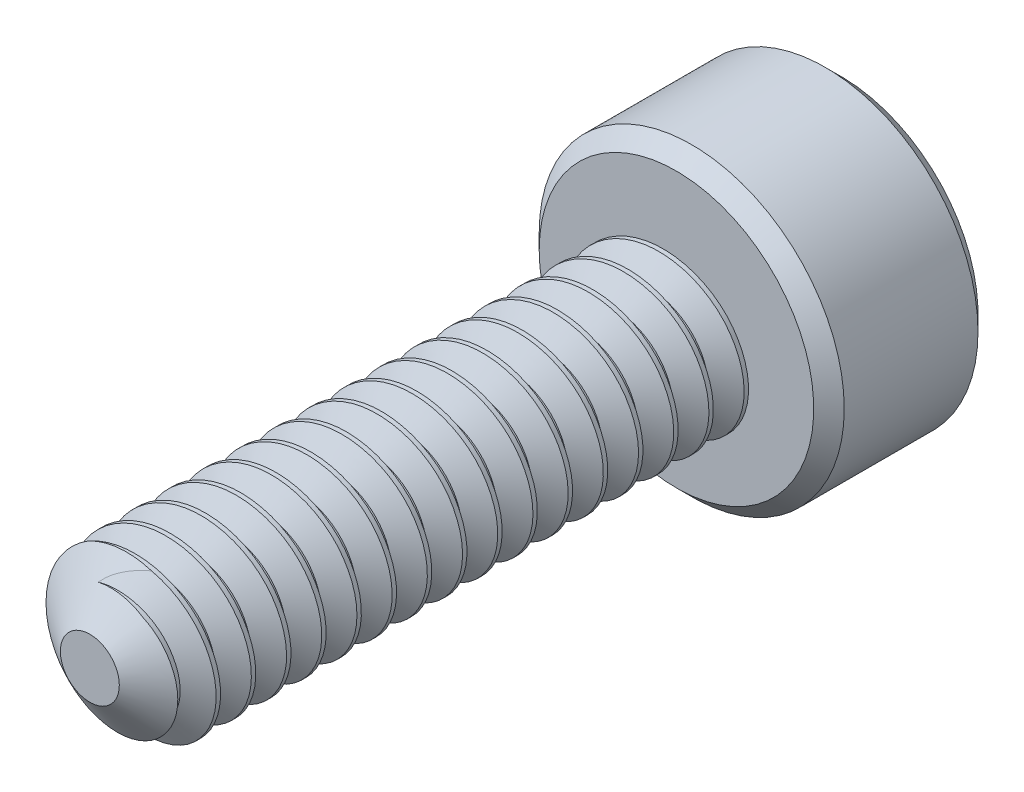
from build123d import *

# Parameters (mm, degrees)
SKETCH1_R          = 0.7
EXTRUDE1_DEPTH     = 5
CUT_SWEEP1_PITCH   = 0.3
SKETCH6_R          = 1.3
EXTRUDE2_DEPTH     = 1.4
CUT_EXTRUDE1_DEPTH = 0.975
CHAMFER1_SIZE      = 0.13


with BuildPart() as part:
    # Sketch1 → Extrude1 (new body)
    with BuildSketch(Plane.XY):
        Circle(SKETCH1_R)
    extrude(amount=-EXTRUDE1_DEPTH)

    # Cut-Sweep1: the profile of Sketch3 profile screwed along a right-hand helix of 17.666667 turns, 6 arcs to a turn; built about Z, then put on its axis
    cut_sweep1_z = Axis((0, 0, 0), (0, 0, 1))
    cut_sweep1_corners = [(0.7003, 0, -0.262673205), (0.505144284, 0, -0.15), (0.505144284, 0, -0.1125), (0.7003, 0, 0.000173205)]
    with BuildLine(mode=Mode.PRIVATE) as cut_sweep1_profile:
        Line(cut_sweep1_corners[0], cut_sweep1_corners[1])
        Line(cut_sweep1_corners[1], cut_sweep1_corners[2])
        Line(cut_sweep1_corners[2], cut_sweep1_corners[3])
        Line(cut_sweep1_corners[3], cut_sweep1_corners[0])
    cut_sweep1_cap = Face(cut_sweep1_profile.wire())
    cut_sweep1_turn_angles = [0, 30, 60, 90, 120, 150, 180, 210, 240, 270, 300, 330, 360]
    cut_sweep1_turn_weights = [1, 0.8660254037844387, 1, 0.8660254037844387, 1, 0.8660254037844387, 1, 0.8660254037844387, 1, 0.8660254037844387, 1, 0.8660254037844387, 1]
    cut_sweep1_turn_rails = [Edge.make_bspline([Vector(p[0], p[1], 0).rotate(cut_sweep1_z, cut_sweep1_turn_angles[k]) / cut_sweep1_turn_weights[k] + Vector(0, 0, p[2] + CUT_SWEEP1_PITCH * cut_sweep1_turn_angles[k] / 360) for k in range(13)], [0, 0, 0, 1, 1, 2, 2, 3, 3, 4, 4, 5, 5, 6, 6, 6], 2, cut_sweep1_turn_weights) for p in cut_sweep1_corners]
    cut_sweep1_turn_sides = [Face.make_surface_from_curves(cut_sweep1_turn_rails[p[0]], cut_sweep1_turn_rails[p[1]]) for p in [(0, 1), (1, 2), (2, 3), (3, 0)]]
    cut_sweep1_last_angles = [6120, 6150, 6180, 6210, 6240, 6270, 6300, 6330, 6360]
    cut_sweep1_last_weights = [1, 0.8660254037844387, 1, 0.8660254037844387, 1, 0.8660254037844387, 1, 0.8660254037843077, 1]
    cut_sweep1_last_rails = [Edge.make_bspline([Vector(p[0], p[1], 0).rotate(cut_sweep1_z, cut_sweep1_last_angles[k]) / cut_sweep1_last_weights[k] + Vector(0, 0, p[2] + CUT_SWEEP1_PITCH * cut_sweep1_last_angles[k] / 360) for k in range(9)], [0, 0, 0, 1, 1, 2, 2, 3, 3, 4, 4, 4], 2, cut_sweep1_last_weights) for p in cut_sweep1_corners]
    cut_sweep1_last_sides = [Face.make_surface_from_curves(cut_sweep1_last_rails[p[0]], cut_sweep1_last_rails[p[1]]) for p in [(0, 1), (1, 2), (2, 3), (3, 0)]]
    cut_sweep1 = Plane(origin=(0, 0, 0), x_dir=(0, 1, 0), z_dir=(0, 0, -1)) * Solid(Shell([*[p.moved(Location((0, 0, CUT_SWEEP1_PITCH * i))) for i in range(17) for p in cut_sweep1_turn_sides], *cut_sweep1_last_sides, cut_sweep1_cap, cut_sweep1_cap.rotate(cut_sweep1_z, 6360).moved(Location((0, 0, CUT_SWEEP1_PITCH * 6360 / 360)))]))
    add(cut_sweep1, mode=Mode.SUBTRACT)

    # Sketch4 → Cut-Revolve1 (revolve, cut)
    with BuildSketch(Plane(origin=(0, 0, 0), x_dir=(0, 0, -1), z_dir=(1, 0, 0)), mode=Mode.PRIVATE) as cut_revolve1_sk:
        Polygon((0.314292156, 0.7), (0, 0.251144284), (0, 0.7), align=None)
    revolve(cut_revolve1_sk.sketch.rotate(Axis((0, 0, 0), (0, 0, -1)), 332.054099267), axis=Axis((0, 0, 0), (0, 0, -1)), mode=Mode.SUBTRACT)

    # Sketch6 → Extrude2 (add)
    with BuildSketch(Plane(origin=(0, 0, -5), x_dir=(-1, 0, 0), z_dir=(0, 0, -1))):
        Circle(SKETCH6_R)
    extrude(amount=EXTRUDE2_DEPTH)

    # Sketch7 → Cut-Extrude1 (cut)
    with BuildSketch(Plane(origin=(0, 0, -6.4), x_dir=(-1, 0, 0), z_dir=(0, 0, -1))):
        Polygon((0, 0.75055535), (-0.65, 0.375277675), (-0.65, -0.375277675), (0, -0.75055535), (0.65, -0.375277675), (0.65, 0.375277675), align=None)
    extrude(amount=-CUT_EXTRUDE1_DEPTH, mode=Mode.SUBTRACT)

    # Cut-Extrude2 cone 1 section (through the dimple's axis) → Cut-Extrude2 (revolve, cut)
    with BuildSketch(Plane(origin=(0, 0, -6.4), x_dir=(0, 1, 0), z_dir=(1, 0, 0))):
        Polygon((0, 0), (0.75055535, 0), (0, 0.75055535), align=None)
    revolve(axis=Axis((0, 0, -6.4), (0, 0, 1)), mode=Mode.SUBTRACT)

    # Chamfer1
    chamfer1_edges = [part.edges().sort_by_distance(p)[0] for p in [
        (1.3, 0, -5),
        (1.3, 0, -6.4),
    ]]
    chamfer(chamfer1_edges, length=CHAMFER1_SIZE)


solid = part.part
